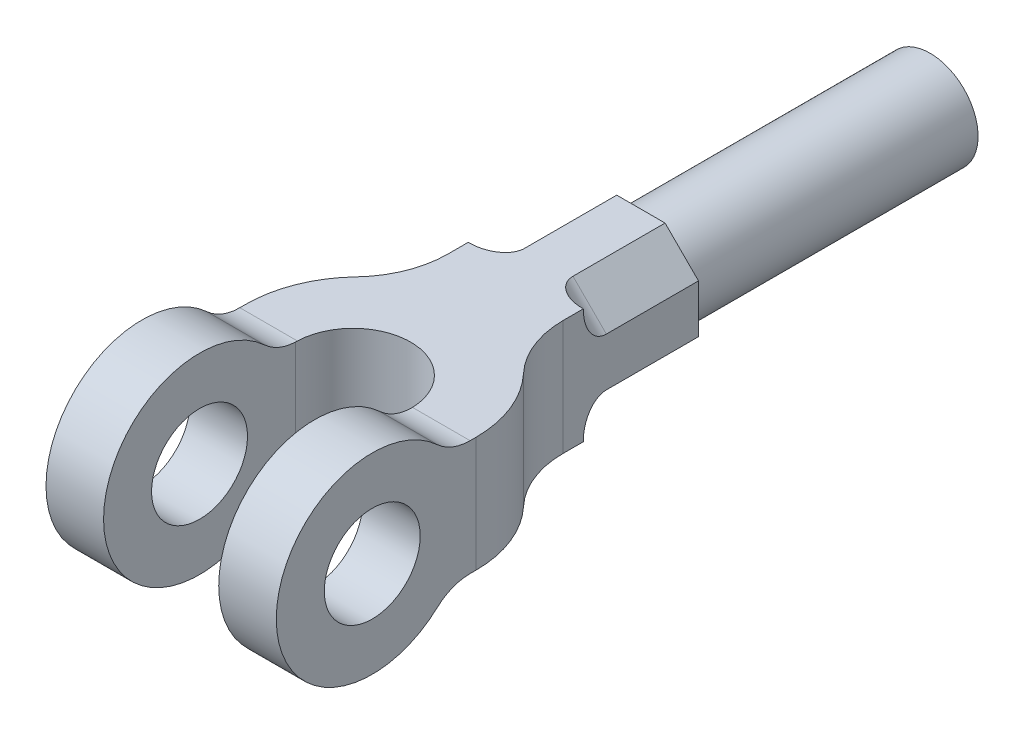
from build123d import *

# Parameters (mm, degrees)
SKETCH2_W           = 1200
SKETCH2_H           = 2500
BOSS_EXTRUDE1_DEPTH = 1000
CUT_EXTRUDE4_DEPTH  = 2948.880594597
CUT_EXTRUDE5_DEPTH  = 2948.880594597
SKETCH4_R           = 250
CUT_EXTRUDE6_DEPTH  = 2948.880594597
CUT_EXTRUDE7_DEPTH  = 600
SKETCH5_3_R         = 250
BOSS_EXTRUDE2_DEPTH = 1507
FILLET2_R           = 120
FILLET3_R           = 120
FILLET4_R           = 120
FILLET5_R           = 120


with BuildPart() as part:
    # Sketch2 → Boss-Extrude1 (new body)
    with BuildSketch(Plane(origin=(0, 0, 0), x_dir=(1, 0, 0), z_dir=(0, 1, 0))):
        with Locations((-600, 1250)):
            Rectangle(SKETCH2_W, SKETCH2_H)
    extrude(amount=BOSS_EXTRUDE1_DEPTH)

    # Sketch3 → Cut-Extrude4 (cut, through all)
    with BuildSketch(Plane(origin=(0, 1000, 0), x_dir=(1, 0, 0), z_dir=(0, 1, 0))):
        with BuildLine():
            Line((-900, 1794.983443527), (-900, 2500))
            Line((-900, 2500), (-1200, 2500))
            Line((-1200, 2500), (-1200, 1040))
            ThreePointArc((-1200, 1040), (-1157.592226371, 1261.564683763), (-1036.363636364, 1451.809151015))
            ThreePointArc((-1036.363636364, 1451.809151015), (-935.339811358, 1610.346207058), (-900, 1794.983443527))
        make_face()
        with BuildLine():
            Line((0, 2500), (-300, 2500))
            Line((-300, 2500), (-300, 1794.983443527))
            ThreePointArc((-300, 1794.983443527), (-264.660188642, 1610.346207058), (-163.636363636, 1451.809151015))
            ThreePointArc((-163.636363636, 1451.809151015), (-42.407773629, 1261.564683763), (0, 1040))
            Line((0, 1040), (0, 2500))
        make_face()
    extrude(amount=-CUT_EXTRUDE4_DEPTH, mode=Mode.SUBTRACT)

    # Sketch3<4> → Cut-Extrude5 (cut, through all)
    with BuildSketch(Plane(origin=(0, 1000, 0), x_dir=(1, 0, 0), z_dir=(0, 1, 0))):
        with BuildLine():
            ThreePointArc((-300, 1000), (-600, 1300), (-900, 1000))
            Line((-900, 1000), (-900, 0))
            Line((-900, 0), (-300, 0))
            Line((-300, 0), (-300, 1000))
        make_face()
    extrude(amount=-CUT_EXTRUDE5_DEPTH, mode=Mode.SUBTRACT)

    # Sketch4 → Cut-Extrude6 (cut, through all)
    with BuildSketch(Plane(origin=(0, 0, 0), x_dir=(0, 0, -1), z_dir=(1, 0, 0))):
        with BuildLine():
            Line((2500, 800), (2500, 1000))
            Line((2500, 1000), (500.000001046, 1000))
            ThreePointArc((500.000001046, 1000), (682.574186322, 965.474667935), (839.93463424, 866.666666667))
            ThreePointArc((839.93463424, 866.666666667), (918.614858442, 817.262665937), (1009.901951359, 800))
            Line((1009.901951359, 800), (2500, 800))
        make_face()
        with BuildLine():
            Line((2500, 0), (2500, 200))
            Line((2500, 200), (1009.901951359, 200))
            ThreePointArc((1009.901951359, 200), (918.614858442, 182.737334063), (839.93463424, 133.333333333))
            ThreePointArc((839.93463424, 133.333333333), (682.574185835, 34.525331874), (500, 0))
            Line((500, 0), (2500, 0))
        make_face()
        with BuildLine():
            ThreePointArc((0, 500), (146.446609777, 853.553390963), (500.000001046, 1000))
            Line((500.000001046, 1000), (0, 1000))
            Line((0, 1000), (0, 500))
        make_face()
        with BuildLine():
            Line((0, 0), (500, 0))
            ThreePointArc((500, 0), (146.446609407, 146.446609407), (0, 500))
            Line((0, 500), (0, 0))
        make_face()
        with Locations((500, 500)):
            Circle(SKETCH4_R)
    extrude(amount=-CUT_EXTRUDE6_DEPTH, mode=Mode.SUBTRACT)

    # Sketch5 → Cut-Extrude7 (cut)
    with BuildSketch(Plane(origin=(0, 0, -2500), x_dir=(-1, 0, 0), z_dir=(0, 0, -1))):
        Polygon((900, 626), (900, 800), (726, 800), align=None)
        Polygon((900, 200), (900, 374), (726, 200), align=None)
        Polygon((300, 626), (474, 800), (300, 800), align=None)
        Polygon((474, 200), (300, 374), (300, 200), align=None)
    extrude(amount=-CUT_EXTRUDE7_DEPTH, mode=Mode.SUBTRACT)

    # Sketch5<3> → Boss-Extrude2 (add)
    with BuildSketch(Plane(origin=(0, 0, -2500), x_dir=(-1, 0, 0), z_dir=(0, 0, -1))):
        with Locations((600, 500)):
            Circle(SKETCH5_3_R)
    extrude(amount=BOSS_EXTRUDE2_DEPTH)

    # Fillet2
    fillet2_edges = [part.edges().sort_by_distance(p)[0] for p in [
        (-387, 713, -1900),
    ]]
    fillet(fillet2_edges, radius=FILLET2_R)

    # Fillet3
    fillet3_edges = [part.edges().sort_by_distance(p)[0] for p in [
        (-387, 287, -1900),
    ]]
    fillet(fillet3_edges, radius=FILLET3_R)

    # Fillet4
    fillet4_edges = [part.edges().sort_by_distance(p)[0] for p in [
        (-813, 713, -1900),
    ]]
    fillet(fillet4_edges, radius=FILLET4_R)

    # Fillet5
    fillet5_edges = [part.edges().sort_by_distance(p)[0] for p in [
        (-813, 287, -1900),
    ]]
    fillet(fillet5_edges, radius=FILLET5_R)


solid = part.part
